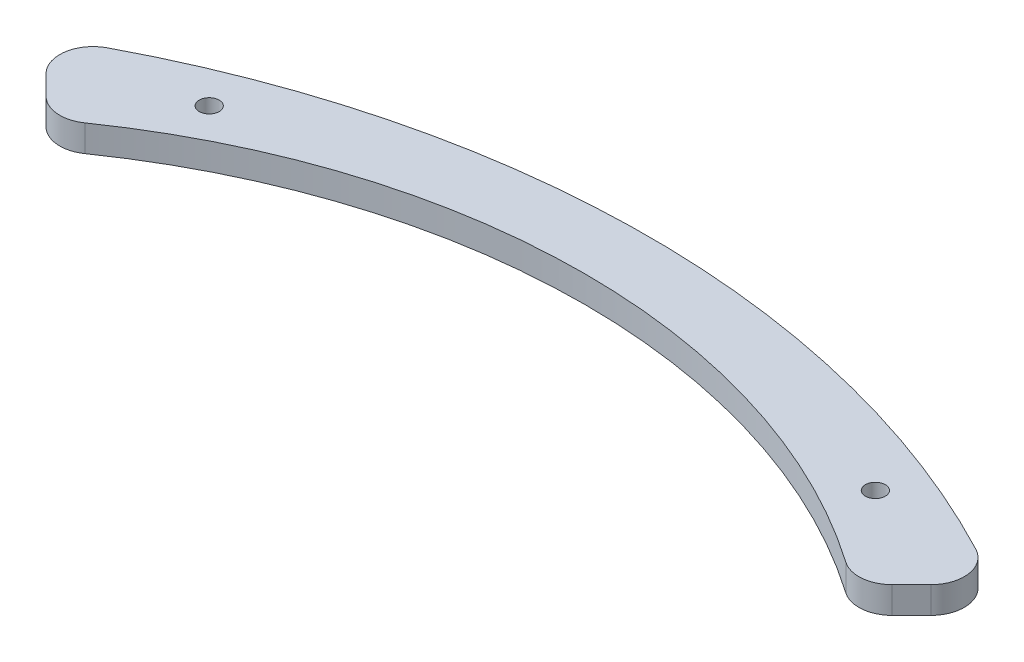
from build123d import *

# Parameters (mm, degrees)
BOSS_EXTRUDE1_DEPTH = 4
FILLET1_R           = 5
CUT_EXTRUDE1_REACH  = 157.643
SKETCH2_R           = 1.5


with BuildPart() as part:
    # Sketch1 → Boss-Extrude1 (new body)
    with BuildSketch(Plane(origin=(0, 0, 0), x_dir=(1, 0, 0), z_dir=(0, 1, 0))):
        with BuildLine():
            Line((-71.102710222, 120.600184905), (-60.496108504, 109.993583187))
            ThreePointArc((-60.496108504, 109.993583187), (0, 130.368079384), (60.496108504, 109.993583187))
            Line((60.496108504, 109.993583187), (71.102710222, 120.600184905))
            ThreePointArc((71.102710222, 120.600184905), (0, 140), (-71.102710222, 120.600184905))
        make_face()
    extrude(amount=BOSS_EXTRUDE1_DEPTH)

    # Fillet1
    fillet1_edges = [part.edges().sort_by_distance(p)[0] for p in [
        (71.102710222, 2, -120.600184905),
        (60.496108504, 2, -109.993583187),
        (-71.102710222, 2, -120.600184905),
        (-60.496108504, 2, -109.993583187),
    ]]
    fillet(fillet1_edges, radius=FILLET1_R)

    # Sketch2 → Cut-Extrude1 (cut, up to next)
    with BuildSketch(Plane(origin=(0, 4, 0), x_dir=(1, 0, 0), z_dir=(0, 1, 0)), mode=Mode.PRIVATE) as cut_extrude1_sk1:
        with Locations((-50, 124)):
            Circle(SKETCH2_R)
    cut_extrude1_tool1 = extrude(cut_extrude1_sk1.sketch, amount=-CUT_EXTRUDE1_REACH, mode=Mode.PRIVATE) & part.part
    # Sketch2 → Cut-Extrude1 (cut, up to next)
    with BuildSketch(Plane(origin=(0, 4, 0), x_dir=(1, 0, 0), z_dir=(0, 1, 0)), mode=Mode.PRIVATE) as cut_extrude1_sk2:
        with Locations((50, 124)):
            Circle(SKETCH2_R)
    cut_extrude1_tool2 = extrude(cut_extrude1_sk2.sketch, amount=-CUT_EXTRUDE1_REACH, mode=Mode.PRIVATE) & part.part
    add(cut_extrude1_tool1.solids().sort_by_distance((-50, 4, -124))[0], mode=Mode.SUBTRACT)
    add(cut_extrude1_tool2.solids().sort_by_distance((50, 4, -124))[0], mode=Mode.SUBTRACT)


solid = part.part
